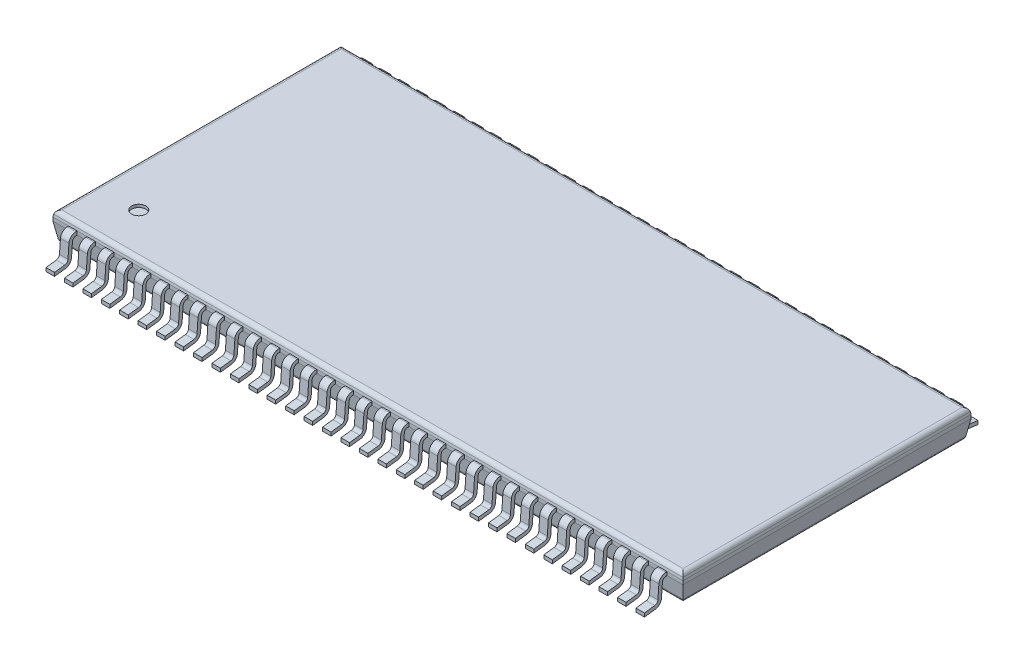
from build123d import *
from OCP.BRepFilletAPI import BRepFilletAPI_MakeChamfer

# Parameters (mm, degrees)
SKETCH1_W             = 22.22
SKETCH1_H             = 10.16
EXTRUDE1_DEPTH        = 0.5
CHAMFER3_SIZE         = 0.21
CHAMFER3_SIZE2        = 0.037
CHAMFER4_SIZE         = 0.117
CHAMFER4_SIZE2        = 0.665
FILLET1_R             = 0.15
SKETCH4_R             = 0.25
CUT_EXTRUDE1_DEPTH    = 0.1
EXTRUDE2_DEPTH        = 0.15
LPATTERN1_COUNT       = 33
LPATTERN1_PITCH       = 0.65
MIRROR1_COPY_1_DEPTH  = 0.15
MIRROR1_COPY_2_DEPTH  = 0.15
MIRROR1_COPY_3_DEPTH  = 0.15
MIRROR1_COPY_4_DEPTH  = 0.15
MIRROR1_COPY_5_DEPTH  = 0.15
MIRROR1_COPY_6_DEPTH  = 0.15
MIRROR1_COPY_7_DEPTH  = 0.15
MIRROR1_COPY_8_DEPTH  = 0.15
MIRROR1_COPY_9_DEPTH  = 0.15
MIRROR1_COPY_10_DEPTH = 0.15
MIRROR1_COPY_11_DEPTH = 0.15
MIRROR1_COPY_12_DEPTH = 0.15
MIRROR1_COPY_13_DEPTH = 0.15
MIRROR1_COPY_14_DEPTH = 0.15
MIRROR1_COPY_15_DEPTH = 0.15
MIRROR1_COPY_16_DEPTH = 0.15
MIRROR1_COPY_17_DEPTH = 0.15
MIRROR1_COPY_18_DEPTH = 0.15
MIRROR1_COPY_19_DEPTH = 0.15
MIRROR1_COPY_20_DEPTH = 0.15
MIRROR1_COPY_21_DEPTH = 0.15
MIRROR1_COPY_22_DEPTH = 0.15
MIRROR1_COPY_23_DEPTH = 0.15
MIRROR1_COPY_24_DEPTH = 0.15
MIRROR1_COPY_25_DEPTH = 0.15
MIRROR1_COPY_26_DEPTH = 0.15
MIRROR1_COPY_27_DEPTH = 0.15
MIRROR1_COPY_28_DEPTH = 0.15
MIRROR1_COPY_29_DEPTH = 0.15
MIRROR1_COPY_30_DEPTH = 0.15
MIRROR1_COPY_31_DEPTH = 0.15
MIRROR1_COPY_32_DEPTH = 0.15
MIRROR1_COPY_33_DEPTH = 0.15


with BuildPart() as part:
    # Sketch1 → Extrude1 (new, symmetric)
    with BuildSketch(Plane(origin=(0, 0, 0), x_dir=(1, 0, 0), z_dir=(0, 1, 0))):
        Rectangle(SKETCH1_W, SKETCH1_H)
    extrude(amount=EXTRUDE1_DEPTH, both=True)

    # Chamfer3: one chamfer whose edges measure the first distance from different faces: ONE call of the kernel's chamfer builder (chamfer() names one face for all edges)
    chamfer3_edges_1 = [part.edges().sort_by_distance(p)[0] for p in [
        (0, 0.5, -5.08),
    ]]
    chamfer3_side_1 = [part.faces().sort_by_distance(p)[0] for p in [
        (0, 0, -5.08),
    ]]
    chamfer3_edges_2 = [part.edges().sort_by_distance(p)[0] for p in [
        (11.11, 0.5, 0),
    ]]
    chamfer3_side_2 = [part.faces().sort_by_distance(p)[0] for p in [
        (11.11, 0, 0),
    ]]
    chamfer3_edges_3 = [part.edges().sort_by_distance(p)[0] for p in [
        (0, 0.5, 5.08),
    ]]
    chamfer3_side_3 = [part.faces().sort_by_distance(p)[0] for p in [
        (0, 0, 5.08),
    ]]
    chamfer3_edges_4 = [part.edges().sort_by_distance(p)[0] for p in [
        (-11.11, 0.5, 0),
    ]]
    chamfer3_side_4 = [part.faces().sort_by_distance(p)[0] for p in [
        (-11.11, 0, 0),
    ]]
    chamfer3 = BRepFilletAPI_MakeChamfer(part.part.solid().wrapped)
    for e in chamfer3_edges_1:
        chamfer3.Add(CHAMFER3_SIZE, CHAMFER3_SIZE2, e.wrapped, chamfer3_side_1[0].wrapped)  # the first distance lies on this face
    for e in chamfer3_edges_2:
        chamfer3.Add(CHAMFER3_SIZE, CHAMFER3_SIZE2, e.wrapped, chamfer3_side_2[0].wrapped)  # the first distance lies on this face
    for e in chamfer3_edges_3:
        chamfer3.Add(CHAMFER3_SIZE, CHAMFER3_SIZE2, e.wrapped, chamfer3_side_3[0].wrapped)  # the first distance lies on this face
    for e in chamfer3_edges_4:
        chamfer3.Add(CHAMFER3_SIZE, CHAMFER3_SIZE2, e.wrapped, chamfer3_side_4[0].wrapped)  # the first distance lies on this face
    add(Compound.cast(chamfer3.Shape()), mode=Mode.REPLACE)

    # Chamfer4
    chamfer4_edges = [part.edges().sort_by_distance(p)[0] for p in [
        (0, -0.5, 5.08),
        (11.11, -0.5, 0),
        (0, -0.5, -5.08),
        (-11.11, -0.5, 0),
    ]]
    chamfer4_side = [part.faces().sort_by_distance(p)[0] for p in [
        (0, -0.5, 0),
    ]]
    chamfer(chamfer4_edges, length=CHAMFER4_SIZE, length2=CHAMFER4_SIZE2, reference=chamfer4_side[0])

    # Fillet1
    fillet1_edges = [part.edges().sort_by_distance(p)[0] for p in [
        (0, 0.5, 5.043),
        (-11.073, 0.5, 0),
        (0, 0.5, -5.043),
        (11.073, 0.5, 0),
        (0, -0.5, -4.963),
        (-10.993, -0.5, 0),
        (0, -0.5, 4.963),
        (10.993, -0.5, 0),
    ]]
    fillet(fillet1_edges, radius=FILLET1_R)

    # Sketch4 → Cut-Extrude1 (cut)
    with BuildSketch(Plane(origin=(0, 0.5, 0), x_dir=(-1, 0, 0), z_dir=(0, 1, 0))):
        with Locations((9.594842744, 3.564842744)):
            Circle(SKETCH4_R)
    extrude(amount=-CUT_EXTRUDE1_DEPTH, mode=Mode.SUBTRACT)

    # Sketch5 → Extrude2 (add, symmetric)
    with BuildSketch(Plane(origin=(-10.4, 0, 0), x_dir=(0, 0, -1), z_dir=(1, 0, 0))):
        with BuildLine():
            Line((-5.08, 0.165), (-5.122287084, 0.165))
            ThreePointArc((-5.122287084, 0.165), (-5.207536879, 0.131419213), (-5.246982591, 0.048719559))
            Line((-5.246982591, 0.048719559), (-5.28, -0.423451392))
            ThreePointArc((-5.28, -0.423451392), (-5.348256674, -0.578321157), (-5.499526832, -0.654222125))
            Line((-5.499526832, -0.654222125), (-5.88, -0.7))
            Line((-5.88, -0.7), (-5.88, -0.575))
            Line((-5.88, -0.575), (-5.514458922, -0.530117199))
            ThreePointArc((-5.514458922, -0.530117199), (-5.438823843, -0.492166715), (-5.404695506, -0.414731832))
            Line((-5.404695506, -0.414731832), (-5.371678097, 0.057439118))
            ThreePointArc((-5.371678097, 0.057439118), (-5.292786674, 0.222838425), (-5.122287084, 0.29))
            Line((-5.122287084, 0.29), (-5.08, 0.29))
            Line((-5.08, 0.29), (-5.08, 0.165))
        make_face()
    extrude2 = extrude(amount=EXTRUDE2_DEPTH, both=True)

    # LPattern1: Extrude2 ×33
    with Locations(*[(i * LPATTERN1_PITCH, 0, 0) for i in range(1, LPATTERN1_COUNT)]):
        add(extrude2)

    # Mirror1 copy 1 sketch → Mirror1 copy 1 (add, symmetric)
    with BuildSketch(Plane(origin=(-9.75, 0, 0), x_dir=(0, 0, 1), z_dir=(1, 0, 0))):
        with BuildLine():
            Line((-5.08, -0.165), (-5.122287084, -0.165))
            ThreePointArc((-5.122287084, -0.165), (-5.207536879, -0.131419213), (-5.246982591, -0.048719559))
            Line((-5.246982591, -0.048719559), (-5.28, 0.423451392))
            ThreePointArc((-5.28, 0.423451392), (-5.348256674, 0.578321157), (-5.499526832, 0.654222125))
            Line((-5.499526832, 0.654222125), (-5.88, 0.7))
            Line((-5.88, 0.7), (-5.88, 0.575))
            Line((-5.88, 0.575), (-5.514458922, 0.530117199))
            ThreePointArc((-5.514458922, 0.530117199), (-5.438823843, 0.492166715), (-5.404695506, 0.414731832))
            Line((-5.404695506, 0.414731832), (-5.371678097, -0.057439118))
            ThreePointArc((-5.371678097, -0.057439118), (-5.292786674, -0.222838425), (-5.122287084, -0.29))
            Line((-5.122287084, -0.29), (-5.08, -0.29))
            Line((-5.08, -0.29), (-5.08, -0.165))
        make_face()
    extrude(amount=MIRROR1_COPY_1_DEPTH, both=True)

    # Mirror1 copy 2 sketch → Mirror1 copy 2 (add, symmetric)
    with BuildSketch(Plane(origin=(-9.1, 0, 0), x_dir=(0, 0, 1), z_dir=(1, 0, 0))):
        with BuildLine():
            Line((-5.08, -0.165), (-5.122287084, -0.165))
            ThreePointArc((-5.122287084, -0.165), (-5.207536879, -0.131419213), (-5.246982591, -0.048719559))
            Line((-5.246982591, -0.048719559), (-5.28, 0.423451392))
            ThreePointArc((-5.28, 0.423451392), (-5.348256674, 0.578321157), (-5.499526832, 0.654222125))
            Line((-5.499526832, 0.654222125), (-5.88, 0.7))
            Line((-5.88, 0.7), (-5.88, 0.575))
            Line((-5.88, 0.575), (-5.514458922, 0.530117199))
            ThreePointArc((-5.514458922, 0.530117199), (-5.438823843, 0.492166715), (-5.404695506, 0.414731832))
            Line((-5.404695506, 0.414731832), (-5.371678097, -0.057439118))
            ThreePointArc((-5.371678097, -0.057439118), (-5.292786674, -0.222838425), (-5.122287084, -0.29))
            Line((-5.122287084, -0.29), (-5.08, -0.29))
            Line((-5.08, -0.29), (-5.08, -0.165))
        make_face()
    extrude(amount=MIRROR1_COPY_2_DEPTH, both=True)

    # Mirror1 copy 3 sketch → Mirror1 copy 3 (add, symmetric)
    with BuildSketch(Plane(origin=(-8.45, 0, 0), x_dir=(0, 0, 1), z_dir=(1, 0, 0))):
        with BuildLine():
            Line((-5.08, -0.165), (-5.122287084, -0.165))
            ThreePointArc((-5.122287084, -0.165), (-5.207536879, -0.131419213), (-5.246982591, -0.048719559))
            Line((-5.246982591, -0.048719559), (-5.28, 0.423451392))
            ThreePointArc((-5.28, 0.423451392), (-5.348256674, 0.578321157), (-5.499526832, 0.654222125))
            Line((-5.499526832, 0.654222125), (-5.88, 0.7))
            Line((-5.88, 0.7), (-5.88, 0.575))
            Line((-5.88, 0.575), (-5.514458922, 0.530117199))
            ThreePointArc((-5.514458922, 0.530117199), (-5.438823843, 0.492166715), (-5.404695506, 0.414731832))
            Line((-5.404695506, 0.414731832), (-5.371678097, -0.057439118))
            ThreePointArc((-5.371678097, -0.057439118), (-5.292786674, -0.222838425), (-5.122287084, -0.29))
            Line((-5.122287084, -0.29), (-5.08, -0.29))
            Line((-5.08, -0.29), (-5.08, -0.165))
        make_face()
    extrude(amount=MIRROR1_COPY_3_DEPTH, both=True)

    # Mirror1 copy 4 sketch → Mirror1 copy 4 (add, symmetric)
    with BuildSketch(Plane(origin=(-7.8, 0, 0), x_dir=(0, 0, 1), z_dir=(1, 0, 0))):
        with BuildLine():
            Line((-5.08, -0.165), (-5.122287084, -0.165))
            ThreePointArc((-5.122287084, -0.165), (-5.207536879, -0.131419213), (-5.246982591, -0.048719559))
            Line((-5.246982591, -0.048719559), (-5.28, 0.423451392))
            ThreePointArc((-5.28, 0.423451392), (-5.348256674, 0.578321157), (-5.499526832, 0.654222125))
            Line((-5.499526832, 0.654222125), (-5.88, 0.7))
            Line((-5.88, 0.7), (-5.88, 0.575))
            Line((-5.88, 0.575), (-5.514458922, 0.530117199))
            ThreePointArc((-5.514458922, 0.530117199), (-5.438823843, 0.492166715), (-5.404695506, 0.414731832))
            Line((-5.404695506, 0.414731832), (-5.371678097, -0.057439118))
            ThreePointArc((-5.371678097, -0.057439118), (-5.292786674, -0.222838425), (-5.122287084, -0.29))
            Line((-5.122287084, -0.29), (-5.08, -0.29))
            Line((-5.08, -0.29), (-5.08, -0.165))
        make_face()
    extrude(amount=MIRROR1_COPY_4_DEPTH, both=True)

    # Mirror1 copy 5 sketch → Mirror1 copy 5 (add, symmetric)
    with BuildSketch(Plane(origin=(-7.15, 0, 0), x_dir=(0, 0, 1), z_dir=(1, 0, 0))):
        with BuildLine():
            Line((-5.08, -0.165), (-5.122287084, -0.165))
            ThreePointArc((-5.122287084, -0.165), (-5.207536879, -0.131419213), (-5.246982591, -0.048719559))
            Line((-5.246982591, -0.048719559), (-5.28, 0.423451392))
            ThreePointArc((-5.28, 0.423451392), (-5.348256674, 0.578321157), (-5.499526832, 0.654222125))
            Line((-5.499526832, 0.654222125), (-5.88, 0.7))
            Line((-5.88, 0.7), (-5.88, 0.575))
            Line((-5.88, 0.575), (-5.514458922, 0.530117199))
            ThreePointArc((-5.514458922, 0.530117199), (-5.438823843, 0.492166715), (-5.404695506, 0.414731832))
            Line((-5.404695506, 0.414731832), (-5.371678097, -0.057439118))
            ThreePointArc((-5.371678097, -0.057439118), (-5.292786674, -0.222838425), (-5.122287084, -0.29))
            Line((-5.122287084, -0.29), (-5.08, -0.29))
            Line((-5.08, -0.29), (-5.08, -0.165))
        make_face()
    extrude(amount=MIRROR1_COPY_5_DEPTH, both=True)

    # Mirror1 copy 6 sketch → Mirror1 copy 6 (add, symmetric)
    with BuildSketch(Plane(origin=(-6.5, 0, 0), x_dir=(0, 0, 1), z_dir=(1, 0, 0))):
        with BuildLine():
            Line((-5.08, -0.165), (-5.122287084, -0.165))
            ThreePointArc((-5.122287084, -0.165), (-5.207536879, -0.131419213), (-5.246982591, -0.048719559))
            Line((-5.246982591, -0.048719559), (-5.28, 0.423451392))
            ThreePointArc((-5.28, 0.423451392), (-5.348256674, 0.578321157), (-5.499526832, 0.654222125))
            Line((-5.499526832, 0.654222125), (-5.88, 0.7))
            Line((-5.88, 0.7), (-5.88, 0.575))
            Line((-5.88, 0.575), (-5.514458922, 0.530117199))
            ThreePointArc((-5.514458922, 0.530117199), (-5.438823843, 0.492166715), (-5.404695506, 0.414731832))
            Line((-5.404695506, 0.414731832), (-5.371678097, -0.057439118))
            ThreePointArc((-5.371678097, -0.057439118), (-5.292786674, -0.222838425), (-5.122287084, -0.29))
            Line((-5.122287084, -0.29), (-5.08, -0.29))
            Line((-5.08, -0.29), (-5.08, -0.165))
        make_face()
    extrude(amount=MIRROR1_COPY_6_DEPTH, both=True)

    # Mirror1 copy 7 sketch → Mirror1 copy 7 (add, symmetric)
    with BuildSketch(Plane(origin=(-5.85, 0, 0), x_dir=(0, 0, 1), z_dir=(1, 0, 0))):
        with BuildLine():
            Line((-5.08, -0.165), (-5.122287084, -0.165))
            ThreePointArc((-5.122287084, -0.165), (-5.207536879, -0.131419213), (-5.246982591, -0.048719559))
            Line((-5.246982591, -0.048719559), (-5.28, 0.423451392))
            ThreePointArc((-5.28, 0.423451392), (-5.348256674, 0.578321157), (-5.499526832, 0.654222125))
            Line((-5.499526832, 0.654222125), (-5.88, 0.7))
            Line((-5.88, 0.7), (-5.88, 0.575))
            Line((-5.88, 0.575), (-5.514458922, 0.530117199))
            ThreePointArc((-5.514458922, 0.530117199), (-5.438823843, 0.492166715), (-5.404695506, 0.414731832))
            Line((-5.404695506, 0.414731832), (-5.371678097, -0.057439118))
            ThreePointArc((-5.371678097, -0.057439118), (-5.292786674, -0.222838425), (-5.122287084, -0.29))
            Line((-5.122287084, -0.29), (-5.08, -0.29))
            Line((-5.08, -0.29), (-5.08, -0.165))
        make_face()
    extrude(amount=MIRROR1_COPY_7_DEPTH, both=True)

    # Mirror1 copy 8 sketch → Mirror1 copy 8 (add, symmetric)
    with BuildSketch(Plane(origin=(-5.2, 0, 0), x_dir=(0, 0, 1), z_dir=(1, 0, 0))):
        with BuildLine():
            Line((-5.08, -0.165), (-5.122287084, -0.165))
            ThreePointArc((-5.122287084, -0.165), (-5.207536879, -0.131419213), (-5.246982591, -0.048719559))
            Line((-5.246982591, -0.048719559), (-5.28, 0.423451392))
            ThreePointArc((-5.28, 0.423451392), (-5.348256674, 0.578321157), (-5.499526832, 0.654222125))
            Line((-5.499526832, 0.654222125), (-5.88, 0.7))
            Line((-5.88, 0.7), (-5.88, 0.575))
            Line((-5.88, 0.575), (-5.514458922, 0.530117199))
            ThreePointArc((-5.514458922, 0.530117199), (-5.438823843, 0.492166715), (-5.404695506, 0.414731832))
            Line((-5.404695506, 0.414731832), (-5.371678097, -0.057439118))
            ThreePointArc((-5.371678097, -0.057439118), (-5.292786674, -0.222838425), (-5.122287084, -0.29))
            Line((-5.122287084, -0.29), (-5.08, -0.29))
            Line((-5.08, -0.29), (-5.08, -0.165))
        make_face()
    extrude(amount=MIRROR1_COPY_8_DEPTH, both=True)

    # Mirror1 copy 9 sketch → Mirror1 copy 9 (add, symmetric)
    with BuildSketch(Plane(origin=(-4.55, 0, 0), x_dir=(0, 0, 1), z_dir=(1, 0, 0))):
        with BuildLine():
            Line((-5.08, -0.165), (-5.122287084, -0.165))
            ThreePointArc((-5.122287084, -0.165), (-5.207536879, -0.131419213), (-5.246982591, -0.048719559))
            Line((-5.246982591, -0.048719559), (-5.28, 0.423451392))
            ThreePointArc((-5.28, 0.423451392), (-5.348256674, 0.578321157), (-5.499526832, 0.654222125))
            Line((-5.499526832, 0.654222125), (-5.88, 0.7))
            Line((-5.88, 0.7), (-5.88, 0.575))
            Line((-5.88, 0.575), (-5.514458922, 0.530117199))
            ThreePointArc((-5.514458922, 0.530117199), (-5.438823843, 0.492166715), (-5.404695506, 0.414731832))
            Line((-5.404695506, 0.414731832), (-5.371678097, -0.057439118))
            ThreePointArc((-5.371678097, -0.057439118), (-5.292786674, -0.222838425), (-5.122287084, -0.29))
            Line((-5.122287084, -0.29), (-5.08, -0.29))
            Line((-5.08, -0.29), (-5.08, -0.165))
        make_face()
    extrude(amount=MIRROR1_COPY_9_DEPTH, both=True)

    # Mirror1 copy 10 sketch → Mirror1 copy 10 (add, symmetric)
    with BuildSketch(Plane(origin=(-3.9, 0, 0), x_dir=(0, 0, 1), z_dir=(1, 0, 0))):
        with BuildLine():
            Line((-5.08, -0.165), (-5.122287084, -0.165))
            ThreePointArc((-5.122287084, -0.165), (-5.207536879, -0.131419213), (-5.246982591, -0.048719559))
            Line((-5.246982591, -0.048719559), (-5.28, 0.423451392))
            ThreePointArc((-5.28, 0.423451392), (-5.348256674, 0.578321157), (-5.499526832, 0.654222125))
            Line((-5.499526832, 0.654222125), (-5.88, 0.7))
            Line((-5.88, 0.7), (-5.88, 0.575))
            Line((-5.88, 0.575), (-5.514458922, 0.530117199))
            ThreePointArc((-5.514458922, 0.530117199), (-5.438823843, 0.492166715), (-5.404695506, 0.414731832))
            Line((-5.404695506, 0.414731832), (-5.371678097, -0.057439118))
            ThreePointArc((-5.371678097, -0.057439118), (-5.292786674, -0.222838425), (-5.122287084, -0.29))
            Line((-5.122287084, -0.29), (-5.08, -0.29))
            Line((-5.08, -0.29), (-5.08, -0.165))
        make_face()
    extrude(amount=MIRROR1_COPY_10_DEPTH, both=True)

    # Mirror1 copy 11 sketch → Mirror1 copy 11 (add, symmetric)
    with BuildSketch(Plane(origin=(-3.25, 0, 0), x_dir=(0, 0, 1), z_dir=(1, 0, 0))):
        with BuildLine():
            Line((-5.08, -0.165), (-5.122287084, -0.165))
            ThreePointArc((-5.122287084, -0.165), (-5.207536879, -0.131419213), (-5.246982591, -0.048719559))
            Line((-5.246982591, -0.048719559), (-5.28, 0.423451392))
            ThreePointArc((-5.28, 0.423451392), (-5.348256674, 0.578321157), (-5.499526832, 0.654222125))
            Line((-5.499526832, 0.654222125), (-5.88, 0.7))
            Line((-5.88, 0.7), (-5.88, 0.575))
            Line((-5.88, 0.575), (-5.514458922, 0.530117199))
            ThreePointArc((-5.514458922, 0.530117199), (-5.438823843, 0.492166715), (-5.404695506, 0.414731832))
            Line((-5.404695506, 0.414731832), (-5.371678097, -0.057439118))
            ThreePointArc((-5.371678097, -0.057439118), (-5.292786674, -0.222838425), (-5.122287084, -0.29))
            Line((-5.122287084, -0.29), (-5.08, -0.29))
            Line((-5.08, -0.29), (-5.08, -0.165))
        make_face()
    extrude(amount=MIRROR1_COPY_11_DEPTH, both=True)

    # Mirror1 copy 12 sketch → Mirror1 copy 12 (add, symmetric)
    with BuildSketch(Plane(origin=(-2.6, 0, 0), x_dir=(0, 0, 1), z_dir=(1, 0, 0))):
        with BuildLine():
            Line((-5.08, -0.165), (-5.122287084, -0.165))
            ThreePointArc((-5.122287084, -0.165), (-5.207536879, -0.131419213), (-5.246982591, -0.048719559))
            Line((-5.246982591, -0.048719559), (-5.28, 0.423451392))
            ThreePointArc((-5.28, 0.423451392), (-5.348256674, 0.578321157), (-5.499526832, 0.654222125))
            Line((-5.499526832, 0.654222125), (-5.88, 0.7))
            Line((-5.88, 0.7), (-5.88, 0.575))
            Line((-5.88, 0.575), (-5.514458922, 0.530117199))
            ThreePointArc((-5.514458922, 0.530117199), (-5.438823843, 0.492166715), (-5.404695506, 0.414731832))
            Line((-5.404695506, 0.414731832), (-5.371678097, -0.057439118))
            ThreePointArc((-5.371678097, -0.057439118), (-5.292786674, -0.222838425), (-5.122287084, -0.29))
            Line((-5.122287084, -0.29), (-5.08, -0.29))
            Line((-5.08, -0.29), (-5.08, -0.165))
        make_face()
    extrude(amount=MIRROR1_COPY_12_DEPTH, both=True)

    # Mirror1 copy 13 sketch → Mirror1 copy 13 (add, symmetric)
    with BuildSketch(Plane(origin=(-1.95, 0, 0), x_dir=(0, 0, 1), z_dir=(1, 0, 0))):
        with BuildLine():
            Line((-5.08, -0.165), (-5.122287084, -0.165))
            ThreePointArc((-5.122287084, -0.165), (-5.207536879, -0.131419213), (-5.246982591, -0.048719559))
            Line((-5.246982591, -0.048719559), (-5.28, 0.423451392))
            ThreePointArc((-5.28, 0.423451392), (-5.348256674, 0.578321157), (-5.499526832, 0.654222125))
            Line((-5.499526832, 0.654222125), (-5.88, 0.7))
            Line((-5.88, 0.7), (-5.88, 0.575))
            Line((-5.88, 0.575), (-5.514458922, 0.530117199))
            ThreePointArc((-5.514458922, 0.530117199), (-5.438823843, 0.492166715), (-5.404695506, 0.414731832))
            Line((-5.404695506, 0.414731832), (-5.371678097, -0.057439118))
            ThreePointArc((-5.371678097, -0.057439118), (-5.292786674, -0.222838425), (-5.122287084, -0.29))
            Line((-5.122287084, -0.29), (-5.08, -0.29))
            Line((-5.08, -0.29), (-5.08, -0.165))
        make_face()
    extrude(amount=MIRROR1_COPY_13_DEPTH, both=True)

    # Mirror1 copy 14 sketch → Mirror1 copy 14 (add, symmetric)
    with BuildSketch(Plane(origin=(-1.3, 0, 0), x_dir=(0, 0, 1), z_dir=(1, 0, 0))):
        with BuildLine():
            Line((-5.08, -0.165), (-5.122287084, -0.165))
            ThreePointArc((-5.122287084, -0.165), (-5.207536879, -0.131419213), (-5.246982591, -0.048719559))
            Line((-5.246982591, -0.048719559), (-5.28, 0.423451392))
            ThreePointArc((-5.28, 0.423451392), (-5.348256674, 0.578321157), (-5.499526832, 0.654222125))
            Line((-5.499526832, 0.654222125), (-5.88, 0.7))
            Line((-5.88, 0.7), (-5.88, 0.575))
            Line((-5.88, 0.575), (-5.514458922, 0.530117199))
            ThreePointArc((-5.514458922, 0.530117199), (-5.438823843, 0.492166715), (-5.404695506, 0.414731832))
            Line((-5.404695506, 0.414731832), (-5.371678097, -0.057439118))
            ThreePointArc((-5.371678097, -0.057439118), (-5.292786674, -0.222838425), (-5.122287084, -0.29))
            Line((-5.122287084, -0.29), (-5.08, -0.29))
            Line((-5.08, -0.29), (-5.08, -0.165))
        make_face()
    extrude(amount=MIRROR1_COPY_14_DEPTH, both=True)

    # Mirror1 copy 15 sketch → Mirror1 copy 15 (add, symmetric)
    with BuildSketch(Plane(origin=(-0.65, 0, 0), x_dir=(0, 0, 1), z_dir=(1, 0, 0))):
        with BuildLine():
            Line((-5.08, -0.165), (-5.122287084, -0.165))
            ThreePointArc((-5.122287084, -0.165), (-5.207536879, -0.131419213), (-5.246982591, -0.048719559))
            Line((-5.246982591, -0.048719559), (-5.28, 0.423451392))
            ThreePointArc((-5.28, 0.423451392), (-5.348256674, 0.578321157), (-5.499526832, 0.654222125))
            Line((-5.499526832, 0.654222125), (-5.88, 0.7))
            Line((-5.88, 0.7), (-5.88, 0.575))
            Line((-5.88, 0.575), (-5.514458922, 0.530117199))
            ThreePointArc((-5.514458922, 0.530117199), (-5.438823843, 0.492166715), (-5.404695506, 0.414731832))
            Line((-5.404695506, 0.414731832), (-5.371678097, -0.057439118))
            ThreePointArc((-5.371678097, -0.057439118), (-5.292786674, -0.222838425), (-5.122287084, -0.29))
            Line((-5.122287084, -0.29), (-5.08, -0.29))
            Line((-5.08, -0.29), (-5.08, -0.165))
        make_face()
    extrude(amount=MIRROR1_COPY_15_DEPTH, both=True)

    # Mirror1 copy 16 sketch → Mirror1 copy 16 (add, symmetric)
    with BuildSketch(Plane(origin=(0, 0, 0), x_dir=(0, 0, 1), z_dir=(1, 0, 0))):
        with BuildLine():
            Line((-5.08, -0.165), (-5.122287084, -0.165))
            ThreePointArc((-5.122287084, -0.165), (-5.207536879, -0.131419213), (-5.246982591, -0.048719559))
            Line((-5.246982591, -0.048719559), (-5.28, 0.423451392))
            ThreePointArc((-5.28, 0.423451392), (-5.348256674, 0.578321157), (-5.499526832, 0.654222125))
            Line((-5.499526832, 0.654222125), (-5.88, 0.7))
            Line((-5.88, 0.7), (-5.88, 0.575))
            Line((-5.88, 0.575), (-5.514458922, 0.530117199))
            ThreePointArc((-5.514458922, 0.530117199), (-5.438823843, 0.492166715), (-5.404695506, 0.414731832))
            Line((-5.404695506, 0.414731832), (-5.371678097, -0.057439118))
            ThreePointArc((-5.371678097, -0.057439118), (-5.292786674, -0.222838425), (-5.122287084, -0.29))
            Line((-5.122287084, -0.29), (-5.08, -0.29))
            Line((-5.08, -0.29), (-5.08, -0.165))
        make_face()
    extrude(amount=MIRROR1_COPY_16_DEPTH, both=True)

    # Mirror1 copy 17 sketch → Mirror1 copy 17 (add, symmetric)
    with BuildSketch(Plane(origin=(0.65, 0, 0), x_dir=(0, 0, 1), z_dir=(1, 0, 0))):
        with BuildLine():
            Line((-5.08, -0.165), (-5.122287084, -0.165))
            ThreePointArc((-5.122287084, -0.165), (-5.207536879, -0.131419213), (-5.246982591, -0.048719559))
            Line((-5.246982591, -0.048719559), (-5.28, 0.423451392))
            ThreePointArc((-5.28, 0.423451392), (-5.348256674, 0.578321157), (-5.499526832, 0.654222125))
            Line((-5.499526832, 0.654222125), (-5.88, 0.7))
            Line((-5.88, 0.7), (-5.88, 0.575))
            Line((-5.88, 0.575), (-5.514458922, 0.530117199))
            ThreePointArc((-5.514458922, 0.530117199), (-5.438823843, 0.492166715), (-5.404695506, 0.414731832))
            Line((-5.404695506, 0.414731832), (-5.371678097, -0.057439118))
            ThreePointArc((-5.371678097, -0.057439118), (-5.292786674, -0.222838425), (-5.122287084, -0.29))
            Line((-5.122287084, -0.29), (-5.08, -0.29))
            Line((-5.08, -0.29), (-5.08, -0.165))
        make_face()
    extrude(amount=MIRROR1_COPY_17_DEPTH, both=True)

    # Mirror1 copy 18 sketch → Mirror1 copy 18 (add, symmetric)
    with BuildSketch(Plane(origin=(1.3, 0, 0), x_dir=(0, 0, 1), z_dir=(1, 0, 0))):
        with BuildLine():
            Line((-5.08, -0.165), (-5.122287084, -0.165))
            ThreePointArc((-5.122287084, -0.165), (-5.207536879, -0.131419213), (-5.246982591, -0.048719559))
            Line((-5.246982591, -0.048719559), (-5.28, 0.423451392))
            ThreePointArc((-5.28, 0.423451392), (-5.348256674, 0.578321157), (-5.499526832, 0.654222125))
            Line((-5.499526832, 0.654222125), (-5.88, 0.7))
            Line((-5.88, 0.7), (-5.88, 0.575))
            Line((-5.88, 0.575), (-5.514458922, 0.530117199))
            ThreePointArc((-5.514458922, 0.530117199), (-5.438823843, 0.492166715), (-5.404695506, 0.414731832))
            Line((-5.404695506, 0.414731832), (-5.371678097, -0.057439118))
            ThreePointArc((-5.371678097, -0.057439118), (-5.292786674, -0.222838425), (-5.122287084, -0.29))
            Line((-5.122287084, -0.29), (-5.08, -0.29))
            Line((-5.08, -0.29), (-5.08, -0.165))
        make_face()
    extrude(amount=MIRROR1_COPY_18_DEPTH, both=True)

    # Mirror1 copy 19 sketch → Mirror1 copy 19 (add, symmetric)
    with BuildSketch(Plane(origin=(1.95, 0, 0), x_dir=(0, 0, 1), z_dir=(1, 0, 0))):
        with BuildLine():
            Line((-5.08, -0.165), (-5.122287084, -0.165))
            ThreePointArc((-5.122287084, -0.165), (-5.207536879, -0.131419213), (-5.246982591, -0.048719559))
            Line((-5.246982591, -0.048719559), (-5.28, 0.423451392))
            ThreePointArc((-5.28, 0.423451392), (-5.348256674, 0.578321157), (-5.499526832, 0.654222125))
            Line((-5.499526832, 0.654222125), (-5.88, 0.7))
            Line((-5.88, 0.7), (-5.88, 0.575))
            Line((-5.88, 0.575), (-5.514458922, 0.530117199))
            ThreePointArc((-5.514458922, 0.530117199), (-5.438823843, 0.492166715), (-5.404695506, 0.414731832))
            Line((-5.404695506, 0.414731832), (-5.371678097, -0.057439118))
            ThreePointArc((-5.371678097, -0.057439118), (-5.292786674, -0.222838425), (-5.122287084, -0.29))
            Line((-5.122287084, -0.29), (-5.08, -0.29))
            Line((-5.08, -0.29), (-5.08, -0.165))
        make_face()
    extrude(amount=MIRROR1_COPY_19_DEPTH, both=True)

    # Mirror1 copy 20 sketch → Mirror1 copy 20 (add, symmetric)
    with BuildSketch(Plane(origin=(2.6, 0, 0), x_dir=(0, 0, 1), z_dir=(1, 0, 0))):
        with BuildLine():
            Line((-5.08, -0.165), (-5.122287084, -0.165))
            ThreePointArc((-5.122287084, -0.165), (-5.207536879, -0.131419213), (-5.246982591, -0.048719559))
            Line((-5.246982591, -0.048719559), (-5.28, 0.423451392))
            ThreePointArc((-5.28, 0.423451392), (-5.348256674, 0.578321157), (-5.499526832, 0.654222125))
            Line((-5.499526832, 0.654222125), (-5.88, 0.7))
            Line((-5.88, 0.7), (-5.88, 0.575))
            Line((-5.88, 0.575), (-5.514458922, 0.530117199))
            ThreePointArc((-5.514458922, 0.530117199), (-5.438823843, 0.492166715), (-5.404695506, 0.414731832))
            Line((-5.404695506, 0.414731832), (-5.371678097, -0.057439118))
            ThreePointArc((-5.371678097, -0.057439118), (-5.292786674, -0.222838425), (-5.122287084, -0.29))
            Line((-5.122287084, -0.29), (-5.08, -0.29))
            Line((-5.08, -0.29), (-5.08, -0.165))
        make_face()
    extrude(amount=MIRROR1_COPY_20_DEPTH, both=True)

    # Mirror1 copy 21 sketch → Mirror1 copy 21 (add, symmetric)
    with BuildSketch(Plane(origin=(3.25, 0, 0), x_dir=(0, 0, 1), z_dir=(1, 0, 0))):
        with BuildLine():
            Line((-5.08, -0.165), (-5.122287084, -0.165))
            ThreePointArc((-5.122287084, -0.165), (-5.207536879, -0.131419213), (-5.246982591, -0.048719559))
            Line((-5.246982591, -0.048719559), (-5.28, 0.423451392))
            ThreePointArc((-5.28, 0.423451392), (-5.348256674, 0.578321157), (-5.499526832, 0.654222125))
            Line((-5.499526832, 0.654222125), (-5.88, 0.7))
            Line((-5.88, 0.7), (-5.88, 0.575))
            Line((-5.88, 0.575), (-5.514458922, 0.530117199))
            ThreePointArc((-5.514458922, 0.530117199), (-5.438823843, 0.492166715), (-5.404695506, 0.414731832))
            Line((-5.404695506, 0.414731832), (-5.371678097, -0.057439118))
            ThreePointArc((-5.371678097, -0.057439118), (-5.292786674, -0.222838425), (-5.122287084, -0.29))
            Line((-5.122287084, -0.29), (-5.08, -0.29))
            Line((-5.08, -0.29), (-5.08, -0.165))
        make_face()
    extrude(amount=MIRROR1_COPY_21_DEPTH, both=True)

    # Mirror1 copy 22 sketch → Mirror1 copy 22 (add, symmetric)
    with BuildSketch(Plane(origin=(3.9, 0, 0), x_dir=(0, 0, 1), z_dir=(1, 0, 0))):
        with BuildLine():
            Line((-5.08, -0.165), (-5.122287084, -0.165))
            ThreePointArc((-5.122287084, -0.165), (-5.207536879, -0.131419213), (-5.246982591, -0.048719559))
            Line((-5.246982591, -0.048719559), (-5.28, 0.423451392))
            ThreePointArc((-5.28, 0.423451392), (-5.348256674, 0.578321157), (-5.499526832, 0.654222125))
            Line((-5.499526832, 0.654222125), (-5.88, 0.7))
            Line((-5.88, 0.7), (-5.88, 0.575))
            Line((-5.88, 0.575), (-5.514458922, 0.530117199))
            ThreePointArc((-5.514458922, 0.530117199), (-5.438823843, 0.492166715), (-5.404695506, 0.414731832))
            Line((-5.404695506, 0.414731832), (-5.371678097, -0.057439118))
            ThreePointArc((-5.371678097, -0.057439118), (-5.292786674, -0.222838425), (-5.122287084, -0.29))
            Line((-5.122287084, -0.29), (-5.08, -0.29))
            Line((-5.08, -0.29), (-5.08, -0.165))
        make_face()
    extrude(amount=MIRROR1_COPY_22_DEPTH, both=True)

    # Mirror1 copy 23 sketch → Mirror1 copy 23 (add, symmetric)
    with BuildSketch(Plane(origin=(4.55, 0, 0), x_dir=(0, 0, 1), z_dir=(1, 0, 0))):
        with BuildLine():
            Line((-5.08, -0.165), (-5.122287084, -0.165))
            ThreePointArc((-5.122287084, -0.165), (-5.207536879, -0.131419213), (-5.246982591, -0.048719559))
            Line((-5.246982591, -0.048719559), (-5.28, 0.423451392))
            ThreePointArc((-5.28, 0.423451392), (-5.348256674, 0.578321157), (-5.499526832, 0.654222125))
            Line((-5.499526832, 0.654222125), (-5.88, 0.7))
            Line((-5.88, 0.7), (-5.88, 0.575))
            Line((-5.88, 0.575), (-5.514458922, 0.530117199))
            ThreePointArc((-5.514458922, 0.530117199), (-5.438823843, 0.492166715), (-5.404695506, 0.414731832))
            Line((-5.404695506, 0.414731832), (-5.371678097, -0.057439118))
            ThreePointArc((-5.371678097, -0.057439118), (-5.292786674, -0.222838425), (-5.122287084, -0.29))
            Line((-5.122287084, -0.29), (-5.08, -0.29))
            Line((-5.08, -0.29), (-5.08, -0.165))
        make_face()
    extrude(amount=MIRROR1_COPY_23_DEPTH, both=True)

    # Mirror1 copy 24 sketch → Mirror1 copy 24 (add, symmetric)
    with BuildSketch(Plane(origin=(5.2, 0, 0), x_dir=(0, 0, 1), z_dir=(1, 0, 0))):
        with BuildLine():
            Line((-5.08, -0.165), (-5.122287084, -0.165))
            ThreePointArc((-5.122287084, -0.165), (-5.207536879, -0.131419213), (-5.246982591, -0.048719559))
            Line((-5.246982591, -0.048719559), (-5.28, 0.423451392))
            ThreePointArc((-5.28, 0.423451392), (-5.348256674, 0.578321157), (-5.499526832, 0.654222125))
            Line((-5.499526832, 0.654222125), (-5.88, 0.7))
            Line((-5.88, 0.7), (-5.88, 0.575))
            Line((-5.88, 0.575), (-5.514458922, 0.530117199))
            ThreePointArc((-5.514458922, 0.530117199), (-5.438823843, 0.492166715), (-5.404695506, 0.414731832))
            Line((-5.404695506, 0.414731832), (-5.371678097, -0.057439118))
            ThreePointArc((-5.371678097, -0.057439118), (-5.292786674, -0.222838425), (-5.122287084, -0.29))
            Line((-5.122287084, -0.29), (-5.08, -0.29))
            Line((-5.08, -0.29), (-5.08, -0.165))
        make_face()
    extrude(amount=MIRROR1_COPY_24_DEPTH, both=True)

    # Mirror1 copy 25 sketch → Mirror1 copy 25 (add, symmetric)
    with BuildSketch(Plane(origin=(5.85, 0, 0), x_dir=(0, 0, 1), z_dir=(1, 0, 0))):
        with BuildLine():
            Line((-5.08, -0.165), (-5.122287084, -0.165))
            ThreePointArc((-5.122287084, -0.165), (-5.207536879, -0.131419213), (-5.246982591, -0.048719559))
            Line((-5.246982591, -0.048719559), (-5.28, 0.423451392))
            ThreePointArc((-5.28, 0.423451392), (-5.348256674, 0.578321157), (-5.499526832, 0.654222125))
            Line((-5.499526832, 0.654222125), (-5.88, 0.7))
            Line((-5.88, 0.7), (-5.88, 0.575))
            Line((-5.88, 0.575), (-5.514458922, 0.530117199))
            ThreePointArc((-5.514458922, 0.530117199), (-5.438823843, 0.492166715), (-5.404695506, 0.414731832))
            Line((-5.404695506, 0.414731832), (-5.371678097, -0.057439118))
            ThreePointArc((-5.371678097, -0.057439118), (-5.292786674, -0.222838425), (-5.122287084, -0.29))
            Line((-5.122287084, -0.29), (-5.08, -0.29))
            Line((-5.08, -0.29), (-5.08, -0.165))
        make_face()
    extrude(amount=MIRROR1_COPY_25_DEPTH, both=True)

    # Mirror1 copy 26 sketch → Mirror1 copy 26 (add, symmetric)
    with BuildSketch(Plane(origin=(6.5, 0, 0), x_dir=(0, 0, 1), z_dir=(1, 0, 0))):
        with BuildLine():
            Line((-5.08, -0.165), (-5.122287084, -0.165))
            ThreePointArc((-5.122287084, -0.165), (-5.207536879, -0.131419213), (-5.246982591, -0.048719559))
            Line((-5.246982591, -0.048719559), (-5.28, 0.423451392))
            ThreePointArc((-5.28, 0.423451392), (-5.348256674, 0.578321157), (-5.499526832, 0.654222125))
            Line((-5.499526832, 0.654222125), (-5.88, 0.7))
            Line((-5.88, 0.7), (-5.88, 0.575))
            Line((-5.88, 0.575), (-5.514458922, 0.530117199))
            ThreePointArc((-5.514458922, 0.530117199), (-5.438823843, 0.492166715), (-5.404695506, 0.414731832))
            Line((-5.404695506, 0.414731832), (-5.371678097, -0.057439118))
            ThreePointArc((-5.371678097, -0.057439118), (-5.292786674, -0.222838425), (-5.122287084, -0.29))
            Line((-5.122287084, -0.29), (-5.08, -0.29))
            Line((-5.08, -0.29), (-5.08, -0.165))
        make_face()
    extrude(amount=MIRROR1_COPY_26_DEPTH, both=True)

    # Mirror1 copy 27 sketch → Mirror1 copy 27 (add, symmetric)
    with BuildSketch(Plane(origin=(7.15, 0, 0), x_dir=(0, 0, 1), z_dir=(1, 0, 0))):
        with BuildLine():
            Line((-5.08, -0.165), (-5.122287084, -0.165))
            ThreePointArc((-5.122287084, -0.165), (-5.207536879, -0.131419213), (-5.246982591, -0.048719559))
            Line((-5.246982591, -0.048719559), (-5.28, 0.423451392))
            ThreePointArc((-5.28, 0.423451392), (-5.348256674, 0.578321157), (-5.499526832, 0.654222125))
            Line((-5.499526832, 0.654222125), (-5.88, 0.7))
            Line((-5.88, 0.7), (-5.88, 0.575))
            Line((-5.88, 0.575), (-5.514458922, 0.530117199))
            ThreePointArc((-5.514458922, 0.530117199), (-5.438823843, 0.492166715), (-5.404695506, 0.414731832))
            Line((-5.404695506, 0.414731832), (-5.371678097, -0.057439118))
            ThreePointArc((-5.371678097, -0.057439118), (-5.292786674, -0.222838425), (-5.122287084, -0.29))
            Line((-5.122287084, -0.29), (-5.08, -0.29))
            Line((-5.08, -0.29), (-5.08, -0.165))
        make_face()
    extrude(amount=MIRROR1_COPY_27_DEPTH, both=True)

    # Mirror1 copy 28 sketch → Mirror1 copy 28 (add, symmetric)
    with BuildSketch(Plane(origin=(7.8, 0, 0), x_dir=(0, 0, 1), z_dir=(1, 0, 0))):
        with BuildLine():
            Line((-5.08, -0.165), (-5.122287084, -0.165))
            ThreePointArc((-5.122287084, -0.165), (-5.207536879, -0.131419213), (-5.246982591, -0.048719559))
            Line((-5.246982591, -0.048719559), (-5.28, 0.423451392))
            ThreePointArc((-5.28, 0.423451392), (-5.348256674, 0.578321157), (-5.499526832, 0.654222125))
            Line((-5.499526832, 0.654222125), (-5.88, 0.7))
            Line((-5.88, 0.7), (-5.88, 0.575))
            Line((-5.88, 0.575), (-5.514458922, 0.530117199))
            ThreePointArc((-5.514458922, 0.530117199), (-5.438823843, 0.492166715), (-5.404695506, 0.414731832))
            Line((-5.404695506, 0.414731832), (-5.371678097, -0.057439118))
            ThreePointArc((-5.371678097, -0.057439118), (-5.292786674, -0.222838425), (-5.122287084, -0.29))
            Line((-5.122287084, -0.29), (-5.08, -0.29))
            Line((-5.08, -0.29), (-5.08, -0.165))
        make_face()
    extrude(amount=MIRROR1_COPY_28_DEPTH, both=True)

    # Mirror1 copy 29 sketch → Mirror1 copy 29 (add, symmetric)
    with BuildSketch(Plane(origin=(8.45, 0, 0), x_dir=(0, 0, 1), z_dir=(1, 0, 0))):
        with BuildLine():
            Line((-5.08, -0.165), (-5.122287084, -0.165))
            ThreePointArc((-5.122287084, -0.165), (-5.207536879, -0.131419213), (-5.246982591, -0.048719559))
            Line((-5.246982591, -0.048719559), (-5.28, 0.423451392))
            ThreePointArc((-5.28, 0.423451392), (-5.348256674, 0.578321157), (-5.499526832, 0.654222125))
            Line((-5.499526832, 0.654222125), (-5.88, 0.7))
            Line((-5.88, 0.7), (-5.88, 0.575))
            Line((-5.88, 0.575), (-5.514458922, 0.530117199))
            ThreePointArc((-5.514458922, 0.530117199), (-5.438823843, 0.492166715), (-5.404695506, 0.414731832))
            Line((-5.404695506, 0.414731832), (-5.371678097, -0.057439118))
            ThreePointArc((-5.371678097, -0.057439118), (-5.292786674, -0.222838425), (-5.122287084, -0.29))
            Line((-5.122287084, -0.29), (-5.08, -0.29))
            Line((-5.08, -0.29), (-5.08, -0.165))
        make_face()
    extrude(amount=MIRROR1_COPY_29_DEPTH, both=True)

    # Mirror1 copy 30 sketch → Mirror1 copy 30 (add, symmetric)
    with BuildSketch(Plane(origin=(9.1, 0, 0), x_dir=(0, 0, 1), z_dir=(1, 0, 0))):
        with BuildLine():
            Line((-5.08, -0.165), (-5.122287084, -0.165))
            ThreePointArc((-5.122287084, -0.165), (-5.207536879, -0.131419213), (-5.246982591, -0.048719559))
            Line((-5.246982591, -0.048719559), (-5.28, 0.423451392))
            ThreePointArc((-5.28, 0.423451392), (-5.348256674, 0.578321157), (-5.499526832, 0.654222125))
            Line((-5.499526832, 0.654222125), (-5.88, 0.7))
            Line((-5.88, 0.7), (-5.88, 0.575))
            Line((-5.88, 0.575), (-5.514458922, 0.530117199))
            ThreePointArc((-5.514458922, 0.530117199), (-5.438823843, 0.492166715), (-5.404695506, 0.414731832))
            Line((-5.404695506, 0.414731832), (-5.371678097, -0.057439118))
            ThreePointArc((-5.371678097, -0.057439118), (-5.292786674, -0.222838425), (-5.122287084, -0.29))
            Line((-5.122287084, -0.29), (-5.08, -0.29))
            Line((-5.08, -0.29), (-5.08, -0.165))
        make_face()
    extrude(amount=MIRROR1_COPY_30_DEPTH, both=True)

    # Mirror1 copy 31 sketch → Mirror1 copy 31 (add, symmetric)
    with BuildSketch(Plane(origin=(9.75, 0, 0), x_dir=(0, 0, 1), z_dir=(1, 0, 0))):
        with BuildLine():
            Line((-5.08, -0.165), (-5.122287084, -0.165))
            ThreePointArc((-5.122287084, -0.165), (-5.207536879, -0.131419213), (-5.246982591, -0.048719559))
            Line((-5.246982591, -0.048719559), (-5.28, 0.423451392))
            ThreePointArc((-5.28, 0.423451392), (-5.348256674, 0.578321157), (-5.499526832, 0.654222125))
            Line((-5.499526832, 0.654222125), (-5.88, 0.7))
            Line((-5.88, 0.7), (-5.88, 0.575))
            Line((-5.88, 0.575), (-5.514458922, 0.530117199))
            ThreePointArc((-5.514458922, 0.530117199), (-5.438823843, 0.492166715), (-5.404695506, 0.414731832))
            Line((-5.404695506, 0.414731832), (-5.371678097, -0.057439118))
            ThreePointArc((-5.371678097, -0.057439118), (-5.292786674, -0.222838425), (-5.122287084, -0.29))
            Line((-5.122287084, -0.29), (-5.08, -0.29))
            Line((-5.08, -0.29), (-5.08, -0.165))
        make_face()
    extrude(amount=MIRROR1_COPY_31_DEPTH, both=True)

    # Mirror1 copy 32 sketch → Mirror1 copy 32 (add, symmetric)
    with BuildSketch(Plane(origin=(10.4, 0, 0), x_dir=(0, 0, 1), z_dir=(1, 0, 0))):
        with BuildLine():
            Line((-5.08, -0.165), (-5.122287084, -0.165))
            ThreePointArc((-5.122287084, -0.165), (-5.207536879, -0.131419213), (-5.246982591, -0.048719559))
            Line((-5.246982591, -0.048719559), (-5.28, 0.423451392))
            ThreePointArc((-5.28, 0.423451392), (-5.348256674, 0.578321157), (-5.499526832, 0.654222125))
            Line((-5.499526832, 0.654222125), (-5.88, 0.7))
            Line((-5.88, 0.7), (-5.88, 0.575))
            Line((-5.88, 0.575), (-5.514458922, 0.530117199))
            ThreePointArc((-5.514458922, 0.530117199), (-5.438823843, 0.492166715), (-5.404695506, 0.414731832))
            Line((-5.404695506, 0.414731832), (-5.371678097, -0.057439118))
            ThreePointArc((-5.371678097, -0.057439118), (-5.292786674, -0.222838425), (-5.122287084, -0.29))
            Line((-5.122287084, -0.29), (-5.08, -0.29))
            Line((-5.08, -0.29), (-5.08, -0.165))
        make_face()
    extrude(amount=MIRROR1_COPY_32_DEPTH, both=True)

    # Mirror1 copy 33 sketch → Mirror1 copy 33 (add, symmetric)
    with BuildSketch(Plane(origin=(-10.4, 0, 0), x_dir=(0, 0, 1), z_dir=(1, 0, 0))):
        with BuildLine():
            Line((-5.08, -0.165), (-5.122287084, -0.165))
            ThreePointArc((-5.122287084, -0.165), (-5.207536879, -0.131419213), (-5.246982591, -0.048719559))
            Line((-5.246982591, -0.048719559), (-5.28, 0.423451392))
            ThreePointArc((-5.28, 0.423451392), (-5.348256674, 0.578321157), (-5.499526832, 0.654222125))
            Line((-5.499526832, 0.654222125), (-5.88, 0.7))
            Line((-5.88, 0.7), (-5.88, 0.575))
            Line((-5.88, 0.575), (-5.514458922, 0.530117199))
            ThreePointArc((-5.514458922, 0.530117199), (-5.438823843, 0.492166715), (-5.404695506, 0.414731832))
            Line((-5.404695506, 0.414731832), (-5.371678097, -0.057439118))
            ThreePointArc((-5.371678097, -0.057439118), (-5.292786674, -0.222838425), (-5.122287084, -0.29))
            Line((-5.122287084, -0.29), (-5.08, -0.29))
            Line((-5.08, -0.29), (-5.08, -0.165))
        make_face()
    extrude(amount=MIRROR1_COPY_33_DEPTH, both=True)


solid = part.part
